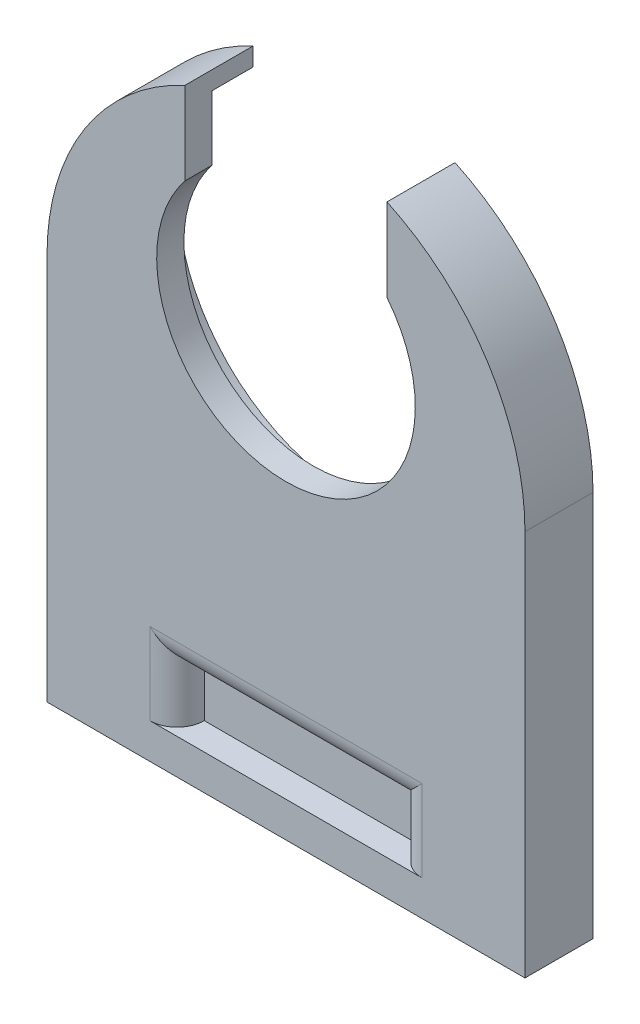
from build123d import *

# Parameters (mm, degrees)
BOSS_EXTRUDE1_DEPTH = 1.5
BOSS_EXTRUDE2_DEPTH = 1
SKETCH4_R           = 4.75
CUT_EXTRUDE1_DEPTH  = 23.898325822
SKETCH5_W           = 17.56
SKETCH5_H           = 2.5
BOSS_EXTRUDE3_DEPTH = 0.15
SKETCH6_W           = 17.56
SKETCH6_H           = 2.5
BOSS_EXTRUDE4_DEPTH = 7.5
SKETCH9_W           = 8
SKETCH9_H           = 2
CUT_EXTRUDE2_DEPTH  = 1
FILLET1_R           = 1
CUT_EXTRUDE3_REACH  = 30.47
SKETCH10_W          = 6.92
SKETCH10_H          = 1
SKETCH11_W          = 2.5
SKETCH11_H          = 3.588872583
CUT_EXTRUDE4_DEPTH  = 0.25


with BuildPart() as part:
    # Sketch1 → Boss-Extrude1 (new body)
    with BuildSketch(Plane.XY):
        with BuildLine():
            ThreePointArc((14.980604809, 6.55), (8.78, 2), (2.579395191, 6.55))
            Line((2.579395191, 6.55), (0, 6.55))
            Line((0, 6.55), (0, 0))
            Line((0, 0), (17.56, 0))
            Line((17.56, 0), (17.56, 6.55))
            Line((17.56, 6.55), (14.980604809, 6.55))
        make_face()
        with BuildLine():
            ThreePointArc((2.579395191, 6.55), (2.679421093, 10.743420825), (5.32, 14.002581212))
            Line((5.32, 14.002581212), (5.32, 14.619498126))
            ThreePointArc((5.32, 14.619498126), (1.449679407, 11.382680416), (0, 6.55))
            Line((0, 6.55), (2.579395191, 6.55))
        make_face()
        with BuildLine():
            ThreePointArc((12.24, 14.002581212), (14.880578907, 10.743420825), (14.980604809, 6.55))
            Line((14.980604809, 6.55), (17.56, 6.55))
            ThreePointArc((17.56, 6.55), (16.110320593, 11.382680416), (12.24, 14.619498126))
            Line((12.24, 14.619498126), (12.24, 14.002581212))
        make_face()
    extrude(amount=BOSS_EXTRUDE1_DEPTH)

    # Sketch3 → Boss-Extrude2 (add)
    with BuildSketch(Plane.XY.offset(1.5)):
        with BuildLine():
            Line((12.24, 14.619498126), (12.24, 14.002581212))
            ThreePointArc((12.24, 14.002581212), (8.78, 2), (5.32, 14.002581212))
            Line((5.32, 14.002581212), (5.32, 14.619498126))
            ThreePointArc((5.32, 14.619498126), (1.449679407, 11.382680416), (0, 6.55))
            Line((0, 6.55), (0, 0))
            Line((0, 0), (17.56, 0))
            Line((17.56, 0), (17.56, 6.55))
            ThreePointArc((17.56, 6.55), (16.110320593, 11.382680416), (12.24, 14.619498126))
        make_face()
        with BuildLine():
            Line((5.32, 14.619498126), (12.24, 14.619498126))
            Line((12.24, 14.619498126), (12.24, 14.002581212))
            ThreePointArc((12.24, 14.002581212), (8.78, 2), (5.32, 14.002581212))
            Line((5.32, 14.002581212), (5.32, 14.619498126))
        make_face()
    extrude(amount=BOSS_EXTRUDE2_DEPTH)

    # Sketch4 → Cut-Extrude1 (cut, through all)
    with BuildSketch(Plane(origin=(0, 0, 1.5), x_dir=(-1, 0, 0), z_dir=(0, 0, -1))):
        with Locations((-8.78, 8.5)):
            Circle(SKETCH4_R)
    extrude(amount=-CUT_EXTRUDE1_DEPTH, mode=Mode.SUBTRACT)

    # Sketch5 → Boss-Extrude3 (add)
    with BuildSketch(Plane.XZ):
        with Locations((8.78, 1.25)):
            Rectangle(SKETCH5_W, SKETCH5_H)
    extrude(amount=BOSS_EXTRUDE3_DEPTH)

    # Sketch6 → Boss-Extrude4 (add)
    with BuildSketch(Plane.XZ.offset(0.15)):
        with Locations((8.78, 1.25)):
            Rectangle(SKETCH6_W, SKETCH6_H)
    extrude(amount=BOSS_EXTRUDE4_DEPTH)

    # Sketch9 → Cut-Extrude2 (cut)
    with BuildSketch(Plane.XY.offset(2.5)):
        with Locations((8.78, -5.353166831)):
            Rectangle(SKETCH9_W, SKETCH9_H)
    extrude(amount=-CUT_EXTRUDE2_DEPTH, mode=Mode.SUBTRACT)

    # Fillet1
    fillet1_edges = [part.edges().sort_by_distance(p)[0] for p in [
        (4.78, -5.353166831, 2.5),
        (12.78, -5.353166831, 2.5),
        (8.78, -4.353166831, 2.5),
    ]]
    fillet(fillet1_edges, radius=FILLET1_R - 0.0001)  # a hair under: the kernel refuses the full size

    # Sketch10 → Cut-Extrude3 (cut, up to next)
    with BuildSketch(Plane(origin=(0, 14.619498126, 0), x_dir=(1, 0, 0), z_dir=(0, 1, 0)), mode=Mode.PRIVATE) as cut_extrude3_sk1:
        with Locations((8.78, -2)):
            Rectangle(SKETCH10_W, SKETCH10_H)
    cut_extrude3_tool1 = extrude(cut_extrude3_sk1.sketch, amount=-CUT_EXTRUDE3_REACH, mode=Mode.PRIVATE) & part.part
    add(cut_extrude3_tool1.solids().sort_by_distance((8.78, 14.619498, 2))[0], mode=Mode.SUBTRACT)

    # Sketch11 → Cut-Extrude4 (cut)
    with BuildSketch(Plane(origin=(5.32, 0, 0), x_dir=(0, 0, -1), z_dir=(1, 0, 0))):
        with Locations((-1.25, 12.825061835)):
            Rectangle(SKETCH11_W, SKETCH11_H)
    cut_extrude4 = extrude(amount=-CUT_EXTRUDE4_DEPTH, mode=Mode.SUBTRACT)

    # Mirror1: Cut-Extrude4 across plane
    add(cut_extrude4.mirror(Plane.ZY.offset(-8.78)), mode=Mode.SUBTRACT)


solid = part.part
